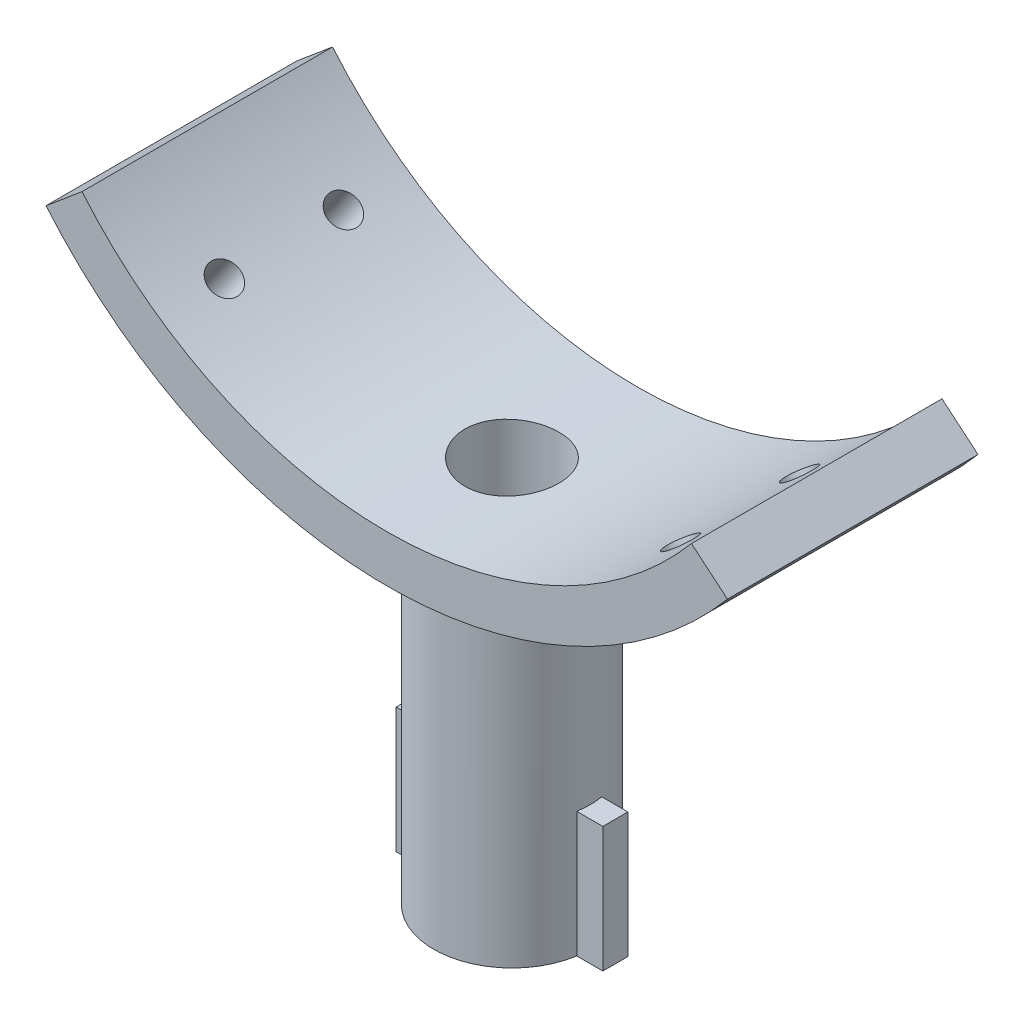
from build123d import *

# Parameters (mm, degrees)
BOSS_EXTRUDE1_DEPTH      = 8
BOSS_EXTRUDE2_REACH      = 42.88
BOSS_EXTRUDE2_END_RADIUS = 28.4
SKETCH2_R                = 5
SKETCH3_R                = 3
CUT_EXTRUDE1_DEPTH       = 41.880226091
BOSS_EXTRUDE3_DEPTH      = 8
SKETCH13_R               = 1
CUT_EXTRUDE2_DEPTH       = 48.183236901


with BuildPart() as part:
    # Sketch1 → Boss-Extrude1 (new, symmetric)
    with BuildSketch(Plane.XY):
        with BuildLine():
            Line((21.755662185, -18.255168115), (19.457528855, -16.326805286))
            ThreePointArc((19.457528855, -16.326805286), (0, -25.4), (-19.457528855, -16.326805286))
            Line((-19.457528855, -16.326805286), (-21.755662185, -18.255168115))
            ThreePointArc((-21.755662185, -18.255168115), (0, -28.4), (21.755662185, -18.255168115))
        make_face()
    extrude(amount=BOSS_EXTRUDE1_DEPTH, both=True)

    # Boss-Extrude2: up to this cylinder (the profile starts outside it)
    boss_extrude2_end = Plane(origin=(0, 0, 0), z_dir=(0, 0, -1)) * Cylinder(BOSS_EXTRUDE2_END_RADIUS, 143.56, mode=Mode.PRIVATE)
    # Sketch2 → Boss-Extrude2 (add, up to the surface)
    with BuildSketch(Plane(origin=(0, -50, 0), x_dir=(1, 0, 0), z_dir=(0, 1, 0)), mode=Mode.PRIVATE) as boss_extrude2_sk1:
        Circle(SKETCH2_R)
    boss_extrude2_tool1 = extrude(boss_extrude2_sk1.sketch, amount=BOSS_EXTRUDE2_REACH, mode=Mode.PRIVATE) - boss_extrude2_end
    add(boss_extrude2_tool1.solids().sort_by_distance((0, -50, 0))[0])

    # Sketch3 → Cut-Extrude1 (cut, through all)
    with BuildSketch(Plane.XZ.offset(50)):
        Circle(SKETCH3_R)
    extrude(amount=-CUT_EXTRUDE1_DEPTH, mode=Mode.SUBTRACT)

    # Sketch4 → Boss-Extrude3 (add)
    with BuildSketch(Plane.XZ.offset(50)):
        with BuildLine():
            Line((-6.6, 0.8), (-4.935585072, 0.8))
            ThreePointArc((-4.935585072, 0.8), (-5, 0), (-4.935585072, -0.8))
            Line((-4.935585072, -0.8), (-6.6, -0.8))
            Line((-6.6, -0.8), (-6.6, 0.8))
        make_face()
        with BuildLine():
            Line((6.6, 0.8), (6.6, -0.8))
            Line((6.6, -0.8), (4.935585072, -0.8))
            ThreePointArc((4.935585072, -0.8), (5, 0), (4.935585072, 0.8))
            Line((4.935585072, 0.8), (6.6, 0.8))
        make_face()
    extrude(amount=-BOSS_EXTRUDE3_DEPTH)

    # Sketch13 → Cut-Extrude2 (cut, through all)
    with BuildSketch(Plane(origin=(16.289570792, -23.263918058, 0), x_dir=(-0.819152044288991, -0.5735764363510473, 0), z_dir=(0.5735764363510473, -0.819152044288991, 0))):
        with Locations((0, 3.8)):
            Circle(SKETCH13_R)
        with Locations((0, -3.8)):
            Circle(SKETCH13_R)
    cut_extrude2 = extrude(amount=-CUT_EXTRUDE2_DEPTH, mode=Mode.SUBTRACT)

    # Mirror1: Cut-Extrude2 across plane
    add(cut_extrude2.mirror(Plane(origin=(0, 0, 0), x_dir=(0, 0, 1), z_dir=(1, 0, 0))), mode=Mode.SUBTRACT)


solid = part.part
